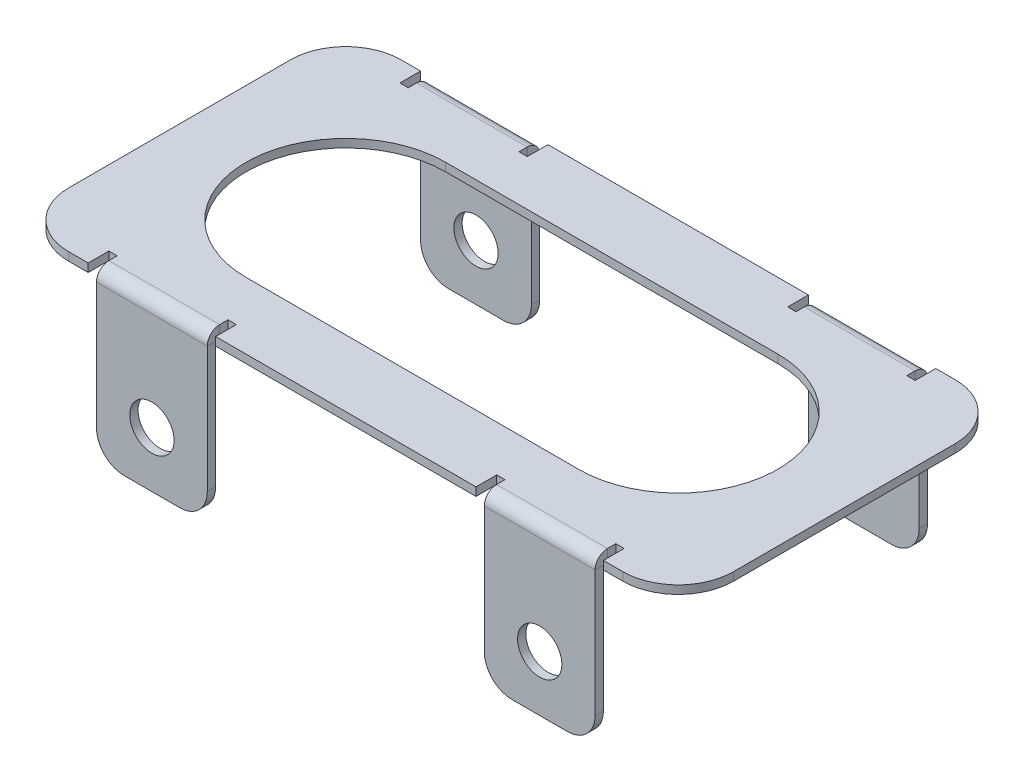
from build123d import *

# Parameters (mm, degrees)
SKETCH1_W                     = 120
SKETCH1_H                     = 60
BASE_FLANGE1_DEPTH            = 1.5
BREAK_CORNER1_START           = -1.5
BREAK_CORNER1_DEPTH           = 1.5
CUT_EXTRUDE1_DEPTH            = 10
EDGE_FLANGE3_STRIP_W          = 7.4732
EDGE_FLANGE3_STRIP_H          = 1.5
EDGE_FLANGE3_STRIP_CUT_DEPTH  = 20
EDGE_FLANGE3_RELIEF_W         = 8.9732
EDGE_FLANGE3_RELIEF_H         = 1.5
EDGE_FLANGE3_RELIEF_CUT_DEPTH = 1.5
EDGE_FLANGE3_DEPTH            = 20
MIRROR2_COPY_1_SKETCH_W       = 7.4732
MIRROR2_COPY_1_SKETCH_H       = 1.5
MIRROR2_COPY_1_DEPTH          = 20
MIRROR2_COPY_2_SKETCH_W       = 8.9732
MIRROR2_COPY_2_SKETCH_H       = 1.5
MIRROR2_COPY_2_DEPTH          = 1.5
MIRROR2_COPY_3_DEPTH          = 20
SKETCH14_R                    = 4
CUT_EXTRUDE2_DEPTH            = 91
BREAK_CORNER2_START           = -30
BREAK_CORNER2_DEPTH           = 60


# Read off the part's stored shape, not the designer's step: Break-Corner1, Break-Corner2
# Sheet-metal steps are written as plain solids
with BuildPart() as part:
    # Sketch1 → Base-Flange1 (new body)
    with BuildSketch(Plane(origin=(0, 0, 0), x_dir=(1, 0, 0), z_dir=(0, 1, 0))):
        Rectangle(SKETCH1_W, SKETCH1_H)
    extrude(amount=-BASE_FLANGE1_DEPTH)

    # Break-Corner1 outline → Break-Corner1 (cut)
    with BuildSketch(Plane(origin=(0, 0, 0), x_dir=(1, 0, 0), z_dir=(0, 1, 0)).offset(BREAK_CORNER1_START)):
        with BuildLine():
            ThreePointArc((50, 30), (57.071067812, 27.071067812), (60, 20))
            Line((60, 20), (60, 30))
            Line((60, 30), (50, 30))
        make_face()
        with BuildLine():
            Line((60, -30), (60, -20))
            ThreePointArc((60, -20), (57.071067812, -27.071067812), (50, -30))
            Line((50, -30), (60, -30))
        make_face()
        with BuildLine():
            ThreePointArc((-60, 20), (-57.071067812, 27.071067812), (-50, 30))
            Line((-50, 30), (-60, 30))
            Line((-60, 30), (-60, 20))
        make_face()
        with BuildLine():
            Line((-60, -30), (-50, -30))
            ThreePointArc((-50, -30), (-57.071067812, -27.071067812), (-60, -20))
            Line((-60, -20), (-60, -30))
        make_face()
    extrude(amount=BREAK_CORNER1_DEPTH, mode=Mode.SUBTRACT)

    # Sketch6 → Cut-Extrude1 (cut)
    with BuildSketch(Plane(origin=(0, 0, 0), x_dir=(1, 0, 0), z_dir=(0, 1, 0))):
        with BuildLine():
            Line((-30, 18), (30, 18))
            ThreePointArc((30, 18), (48, 0), (30, -18))
            Line((30, -18), (-30, -18))
            ThreePointArc((-30, -18), (-48, 0), (-30, 18))
        make_face()
    extrude(amount=-CUT_EXTRUDE1_DEPTH, mode=Mode.SUBTRACT)

    # Edge-Flange3 strip (across the edge) → Edge-Flange3 strip cut (cut)
    with BuildSketch(Plane(origin=(-25, -1.5, 30), x_dir=(0, 0, -1), z_dir=(-1, 0, 0))):
        with Locations((-1.5, -0.75)):
            Rectangle(EDGE_FLANGE3_STRIP_W, EDGE_FLANGE3_STRIP_H)
    edge_flange3_strip_cut = extrude(amount=EDGE_FLANGE3_STRIP_CUT_DEPTH, mode=Mode.SUBTRACT)

    # Edge-Flange3 relief (on the sheet) → Edge-Flange3 relief cut (cut)
    with BuildSketch(Plane(origin=(-25, -1.5, 27.7634), x_dir=(0, 0, -1), z_dir=(0, -1, 0))):
        with Locations((-2.9866, 0.75)):
            Rectangle(EDGE_FLANGE3_RELIEF_W, EDGE_FLANGE3_RELIEF_H)
        with Locations((-2.9866, -20.75)):
            Rectangle(EDGE_FLANGE3_RELIEF_W, EDGE_FLANGE3_RELIEF_H)
    edge_flange3_relief_cut = extrude(amount=-EDGE_FLANGE3_RELIEF_CUT_DEPTH, mode=Mode.SUBTRACT)

    # Edge-Flange3 section (across the edge) → Edge-Flange3 (add)
    with BuildSketch(Plane(origin=(-25, -1.5, 30), x_dir=(0, 0, -1), z_dir=(-1, 0, 0))):
        with BuildLine():
            Line((0, 0.7366), (0, 28.5))
            Line((0, 28.5), (1.5, 28.5))
            Line((1.5, 28.5), (1.5, 0.7366))
            ThreePointArc((1.5, 0.7366), (1.715745145, 0.215745145), (2.2366, 0))
            Line((2.2366, 0), (2.2366, -1.5))
            ThreePointArc((2.2366, -1.5), (0.655084973, -0.844915027), (0, 0.7366))
        make_face()
    edge_flange3 = extrude(amount=EDGE_FLANGE3_DEPTH)

    # Mirror1: Edge-Flange3 strip cut, Edge-Flange3 relief cut, Edge-Flange3 across plane
    add(edge_flange3_strip_cut.mirror(Plane(origin=(0, 0, 0), x_dir=(0, 0, 1), z_dir=(1, 0, 0))), mode=Mode.SUBTRACT)
    add(edge_flange3_relief_cut.mirror(Plane(origin=(0, 0, 0), x_dir=(0, 0, 1), z_dir=(1, 0, 0))), mode=Mode.SUBTRACT)
    add(edge_flange3.mirror(Plane(origin=(0, 0, 0), x_dir=(0, 0, 1), z_dir=(1, 0, 0))))

    # Mirror2: Edge-Flange3 strip cut, Edge-Flange3 relief cut, Edge-Flange3 across plane
    add(edge_flange3_strip_cut.mirror(Plane.XY), mode=Mode.SUBTRACT)
    add(edge_flange3_relief_cut.mirror(Plane.XY), mode=Mode.SUBTRACT)
    add(edge_flange3.mirror(Plane.XY))

    # Mirror2 copy 1 sketch → Mirror2 copy 1 (cut)
    with BuildSketch(Plane(origin=(25, -1.5, -30), x_dir=(0, 0, 1), z_dir=(1, 0, 0))):
        with Locations((-1.5, -0.75)):
            Rectangle(MIRROR2_COPY_1_SKETCH_W, MIRROR2_COPY_1_SKETCH_H)
    extrude(amount=MIRROR2_COPY_1_DEPTH, mode=Mode.SUBTRACT)

    # Mirror2 copy 2 sketch → Mirror2 copy 2 (cut)
    with BuildSketch(Plane(origin=(25, -1.5, -27.7634), x_dir=(0, 0, 1), z_dir=(0, -1, 0))):
        with Locations((-2.9866, 0.75)):
            Rectangle(MIRROR2_COPY_2_SKETCH_W, MIRROR2_COPY_2_SKETCH_H)
        with Locations((-2.9866, -20.75)):
            Rectangle(MIRROR2_COPY_2_SKETCH_W, MIRROR2_COPY_2_SKETCH_H)
    extrude(amount=-MIRROR2_COPY_2_DEPTH, mode=Mode.SUBTRACT)

    # Mirror2 copy 3 sketch → Mirror2 copy 3 (add)
    with BuildSketch(Plane(origin=(25, -1.5, -30), x_dir=(0, 0, 1), z_dir=(1, 0, 0))):
        with BuildLine():
            Line((0, 0.7366), (0, 28.5))
            Line((0, 28.5), (1.5, 28.5))
            Line((1.5, 28.5), (1.5, 0.7366))
            ThreePointArc((1.5, 0.7366), (1.715745145, 0.215745145), (2.2366, 0))
            Line((2.2366, 0), (2.2366, -1.5))
            ThreePointArc((2.2366, -1.5), (0.655084973, -0.844915027), (0, 0.7366))
        make_face()
    extrude(amount=MIRROR2_COPY_3_DEPTH)

    # Sketch14 → Cut-Extrude2 (cut, through all)
    with BuildSketch(Plane.XY.offset(30)):
        with Locations((-35, -20)):
            Circle(SKETCH14_R)
        with Locations((35, -20)):
            Circle(SKETCH14_R)
    extrude(amount=-CUT_EXTRUDE2_DEPTH, mode=Mode.SUBTRACT)

    # Break-Corner2 outline → Break-Corner2 (cut)
    with BuildSketch(Plane.XY.offset(BREAK_CORNER2_START)):
        with BuildLine():
            Line((-25, -30), (-25, -25))
            ThreePointArc((-25, -25), (-26.464466094, -28.535533906), (-30, -30))
            Line((-30, -30), (-25, -30))
        make_face()
        with BuildLine():
            Line((-45, -30), (-40, -30))
            ThreePointArc((-40, -30), (-43.535533906, -28.535533906), (-45, -25))
            Line((-45, -25), (-45, -30))
        make_face()
        with BuildLine():
            Line((45, -30), (45, -25))
            ThreePointArc((45, -25), (43.535533906, -28.535533906), (40, -30))
            Line((40, -30), (45, -30))
        make_face()
        with BuildLine():
            Line((25, -30), (30, -30))
            ThreePointArc((30, -30), (26.464466094, -28.535533906), (25, -25))
            Line((25, -25), (25, -30))
        make_face()
    extrude(amount=BREAK_CORNER2_DEPTH, mode=Mode.SUBTRACT)


solid = part.part
